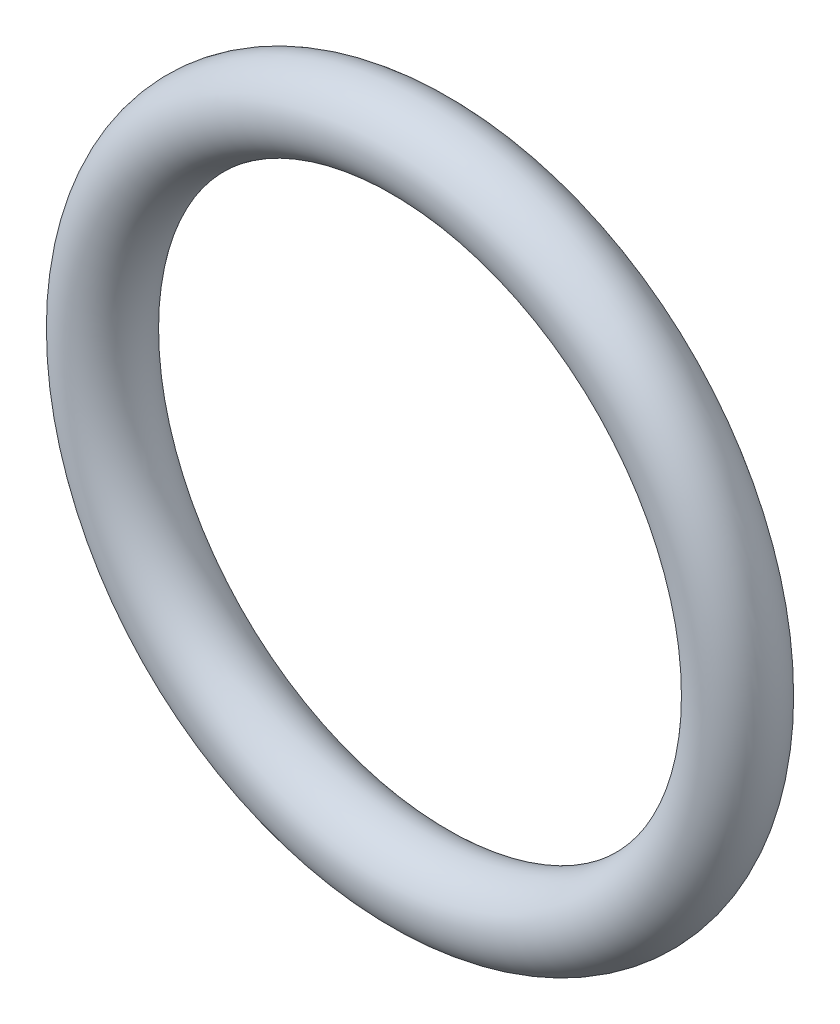
from build123d import *

# Parameters (mm, degrees)
SKETCH3_R = 1.5875


with BuildPart() as part:
    # Sketch3 → Revolve1 (revolve)
    with BuildSketch(Plane(origin=(0, 0, 0), x_dir=(1, 0, 0), z_dir=(0, 1, 0))):
        with Locations((12.7, 0)):
            Circle(SKETCH3_R)
    revolve(axis=Axis((0, 0, 0), (0, 0, -1)))


solid = part.part
